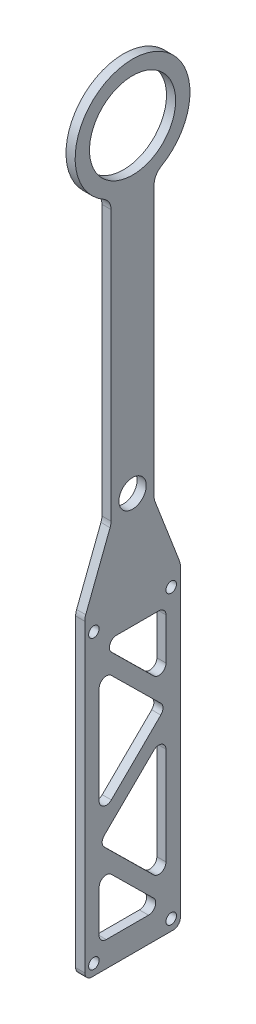
from build123d import *

# Parameters (mm, degrees)
SKETCH1_R           = 1.8288
SKETCH1_R_2         = 4.7625
SKETCH1_R_3         = 15
BOSS_EXTRUDE1_DEPTH = 3.175
CUT_EXTRUDE1_REACH  = 169.323
SKETCH2_W           = 4.112404804
SKETCH2_H           = 134.0475
FILLET3_R           = 2.5
FILLET4_R           = 5


with BuildPart() as part:
    # Sketch1 → Boss-Extrude1 (new body)
    with BuildSketch(Plane(origin=(0, 0, 0), x_dir=(0, 0, -1), z_dir=(1, 0, 0))):
        with BuildLine():
            Line((20.757404804, -103.81), (20.757404804, -5))
            Line((20.757404804, -5), (7.5, 29.435584328))
            Line((7.5, 29.435584328), (7.5, 127.459503782))
            ThreePointArc((7.5, 127.459503782), (0, 166), (-7.5, 127.459503782))
            Line((-7.5, 127.459503782), (-7.5, 29.435584328))
            Line((-7.5, 29.435584328), (-20.757404804, -5))
            Line((-20.757404804, -5), (-20.757404804, -103.81))
            Line((-20.757404804, -103.81), (20.757404804, -103.81))
        make_face()
        with Locations((-13.4747, -100)):
            Circle(SKETCH1_R, mode=Mode.SUBTRACT)
        with Locations((13.4747, -100)):
            Circle(SKETCH1_R, mode=Mode.SUBTRACT)
        with Locations((13.4747, 0)):
            Circle(SKETCH1_R, mode=Mode.SUBTRACT)
        with Locations((-13.4747, 0)):
            Circle(SKETCH1_R, mode=Mode.SUBTRACT)
        with Locations((0, 35)):
            Circle(SKETCH1_R_2, mode=Mode.SUBTRACT)
        with Locations((0, 146)):
            Circle(SKETCH1_R_3, mode=Mode.SUBTRACT)
    extrude(amount=BOSS_EXTRUDE1_DEPTH)

    # Sketch2 → Cut-Extrude1 (cut, up to next)
    with BuildSketch(Plane(origin=(3.175, 0, 0), x_dir=(0, 0, -1), z_dir=(1, 0, 0)), mode=Mode.PRIVATE) as cut_extrude1_sk1:
        Polygon((11.645, -5), (-11.645, -5), (11.645, -27.976379872), align=None)
    cut_extrude1_tool1 = extrude(cut_extrude1_sk1.sketch, amount=-CUT_EXTRUDE1_REACH, mode=Mode.PRIVATE) & part.part
    # Sketch2 → Cut-Extrude1 (cut, up to next)
    with BuildSketch(Plane(origin=(3.175, 0, 0), x_dir=(0, 0, -1), z_dir=(1, 0, 0)), mode=Mode.PRIVATE) as cut_extrude1_sk2:
        Polygon((-11.645, -12.023620128), (11.645, -35), (-11.645, -57.976379872), (-11.645, -35), align=None)
    cut_extrude1_tool2 = extrude(cut_extrude1_sk2.sketch, amount=-CUT_EXTRUDE1_REACH, mode=Mode.PRIVATE) & part.part
    # Sketch2 → Cut-Extrude1 (cut, up to next)
    with BuildSketch(Plane(origin=(3.175, 0, 0), x_dir=(0, 0, -1), z_dir=(1, 0, 0)), mode=Mode.PRIVATE) as cut_extrude1_sk3:
        Polygon((-11.645, -72.023620128), (-11.645, -95), (11.645, -95), align=None)
    cut_extrude1_tool3 = extrude(cut_extrude1_sk3.sketch, amount=-CUT_EXTRUDE1_REACH, mode=Mode.PRIVATE) & part.part
    # Sketch2 → Cut-Extrude1 (cut, up to next)
    with BuildSketch(Plane(origin=(3.175, 0, 0), x_dir=(0, 0, -1), z_dir=(1, 0, 0)), mode=Mode.PRIVATE) as cut_extrude1_sk4:
        Polygon((11.645, -42.023620128), (11.645, -65), (11.645, -87.976379872), (-11.645, -65), align=None)
    cut_extrude1_tool4 = extrude(cut_extrude1_sk4.sketch, amount=-CUT_EXTRUDE1_REACH, mode=Mode.PRIVATE) & part.part
    # Sketch2 → Cut-Extrude1 (cut, up to next)
    with BuildSketch(Plane(origin=(3.175, 0, 0), x_dir=(0, 0, -1), z_dir=(1, 0, 0)), mode=Mode.PRIVATE) as cut_extrude1_sk5:
        with Locations((-18.701202402, -36.78625)):
            Rectangle(SKETCH2_W, SKETCH2_H)
    cut_extrude1_tool5 = extrude(cut_extrude1_sk5.sketch, amount=-CUT_EXTRUDE1_REACH, mode=Mode.PRIVATE) & part.part
    # Sketch2 → Cut-Extrude1 (cut, up to next)
    with BuildSketch(Plane(origin=(3.175, 0, 0), x_dir=(0, 0, -1), z_dir=(1, 0, 0)), mode=Mode.PRIVATE) as cut_extrude1_sk6:
        with Locations((18.701202402, -36.78625)):
            Rectangle(SKETCH2_W, SKETCH2_H)
    cut_extrude1_tool6 = extrude(cut_extrude1_sk6.sketch, amount=-CUT_EXTRUDE1_REACH, mode=Mode.PRIVATE) & part.part
    add(cut_extrude1_tool1.solids().sort_by_distance((3.175, -12.658793, -3.881667))[0], mode=Mode.SUBTRACT)
    add(cut_extrude1_tool2.solids().sort_by_distance((3.175, -35, 3.881667))[0], mode=Mode.SUBTRACT)
    add(cut_extrude1_tool3.solids().sort_by_distance((3.175, -87.341207, 3.881667))[0], mode=Mode.SUBTRACT)
    add(cut_extrude1_tool4.solids().sort_by_distance((3.175, -65, -3.881667))[0], mode=Mode.SUBTRACT)
    add(cut_extrude1_tool5.solids().sort_by_distance((3.175, -36.78625, 18.701202))[0], mode=Mode.SUBTRACT)
    add(cut_extrude1_tool6.solids().sort_by_distance((3.175, -36.78625, -18.701202))[0], mode=Mode.SUBTRACT)

    # Fillet3
    fillet3_edges = [part.edges().sort_by_distance(p)[0] for p in [
        (1.5875, -57.976379872, 11.645),
        (1.5875, -35, -11.645),
        (1.5875, -95, -11.645),
        (1.5875, -72.023620128, 11.645),
        (1.5875, -95, 11.645),
        (1.5875, -27.976379872, -11.645),
        (1.5875, -5, -11.645),
        (1.5875, -12.023620128, 11.645),
        (1.5875, -5, 11.645),
        (1.5875, -87.976379872, -11.645),
        (1.5875, -42.023620128, -11.645),
        (1.5875, -65, 11.645),
        (1.5875, -103.81, -16.645),
        (1.5875, -103.81, 16.645),
    ]]
    fillet(fillet3_edges, radius=FILLET3_R)

    # Fillet4
    fillet4_edges = [part.edges().sort_by_distance(p)[0] for p in [
        (1.5875, 29.435584328, -7.5),
        (1.5875, 29.435584328, 7.5),
        (1.5875, 5.681808734, 16.645),
        (1.5875, 5.681808734, -16.645),
        (1.5875, 127.459503782, -7.5),
        (1.5875, 127.459503782, 7.5),
    ]]
    fillet(fillet4_edges, radius=FILLET4_R)


solid = part.part
